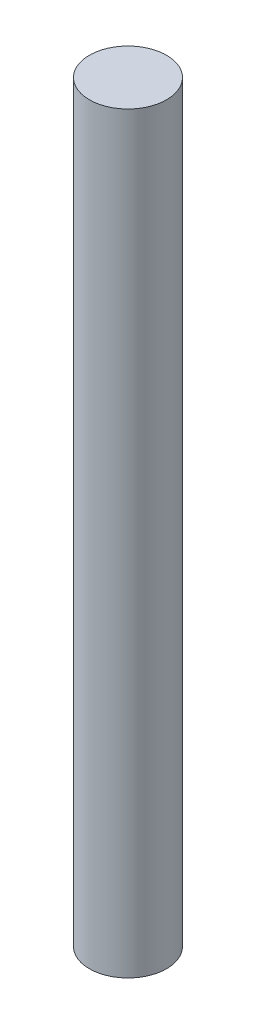
from build123d import *

# Parameters (mm, degrees)
CROQUIS1_R              = 4
SALIENTE_EXTRUIR1_DEPTH = 78


with BuildPart() as part:
    # Croquis1 → Saliente-Extruir1 (new body)
    with BuildSketch(Plane(origin=(0, 0, 0), x_dir=(1, 0, 0), z_dir=(0, 1, 0))):
        Circle(CROQUIS1_R)
    extrude(amount=SALIENTE_EXTRUIR1_DEPTH)


solid = part.part
